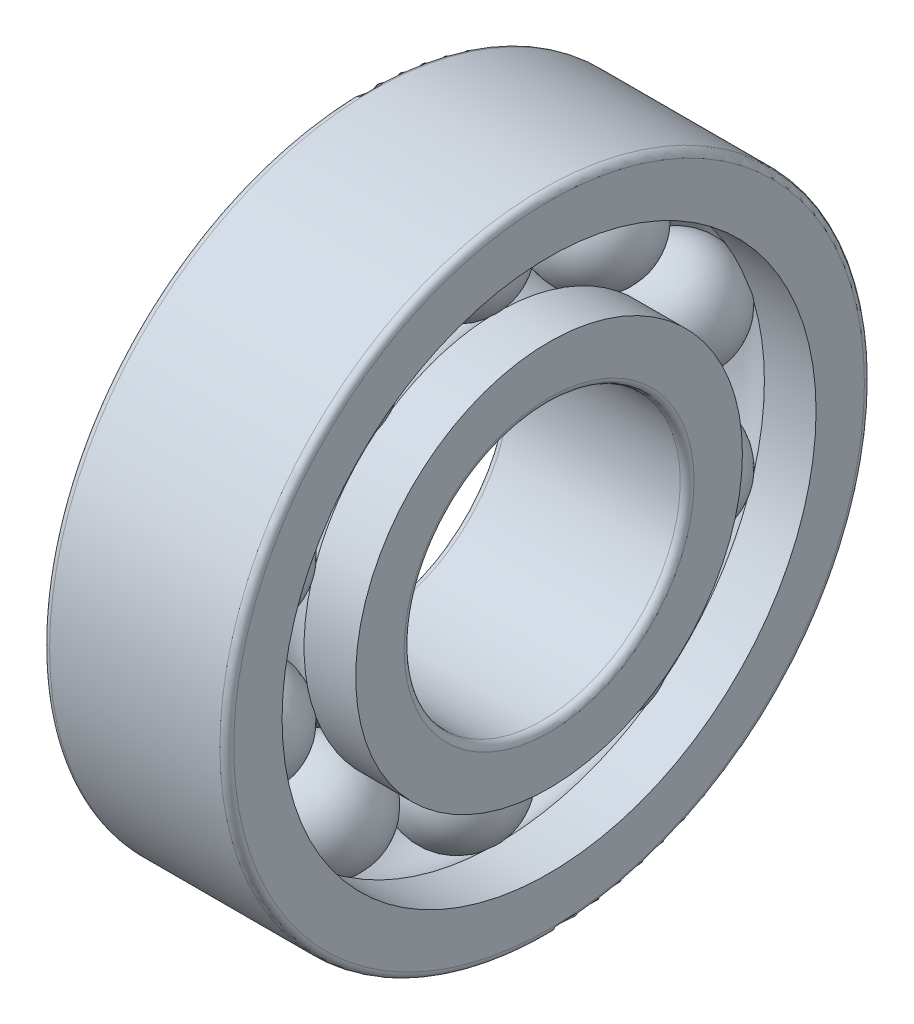
from build123d import *

# Parameters (mm, degrees)
CAGSPISKE_W         = 0.48
CAGSPISKE_H         = 0.8
CAGESPINE_ANGLE     = 0.001
BALLSDETAILED_COUNT = 10
BALLSDETAILED_ANGLE = 324


with BuildPart() as part:
    # CagSpiSke → CageSpine (revolve)
    with BuildSketch(Plane.XY):
        with Locations((0, 10)):
            Rectangle(CAGSPISKE_W, CAGSPISKE_H)
    revolve(axis=Axis((-20.6375, 0, 0), (-1, 0, 0)), revolution_arc=CAGESPINE_ANGLE)

    # BalDetSke → BallDetailed (revolve)
    with BuildSketch(Plane.XY):
        with BuildLine():
            Line((-2.4, 10), (2.4, 10))
            ThreePointArc((2.4, 10), (0, 7.6), (-2.4, 10))
        make_face()
    balldetailed = revolve(axis=Axis((-1.905, 10, 0), (1, 0, 0)))

    # InnRacSke → InnerRace (revolve)
    with BuildSketch(Plane.XY):
        with BuildLine():
            Line((-1.755170932, 8.4), (-4, 8.4))
            Line((-4, 8.4), (-4, 6.3))
            ThreePointArc((-4, 6.3), (-3.912132034, 6.087867966), (-3.7, 6))
            Line((-3.7, 6), (3.7, 6))
            ThreePointArc((3.7, 6), (3.912132034, 6.087867966), (4, 6.3))
            Line((4, 6.3), (4, 8.4))
            Line((4, 8.4), (1.755170932, 8.4))
            ThreePointArc((1.755170932, 8.4), (0, 7.625), (-1.755170932, 8.4))
        make_face()
    revolve(axis=Axis((-20.6375, 0, 0), (1, 0, 0)))

    # OutRacSke → OuterRace (revolve)
    with BuildSketch(Plane.XY):
        with BuildLine():
            Line((-1.755170932, 11.6), (-4, 11.6))
            Line((-4, 11.6), (-4, 13.7))
            ThreePointArc((-4, 13.7), (-3.912132034, 13.912132034), (-3.7, 14))
            Line((-3.7, 14), (3.7, 14))
            ThreePointArc((3.7, 14), (3.912132034, 13.912132034), (4, 13.7))
            Line((4, 13.7), (4, 11.6))
            Line((4, 11.6), (1.755170932, 11.6))
            ThreePointArc((1.755170932, 11.6), (0, 12.375), (-1.755170932, 11.6))
        make_face()
    revolve(axis=Axis((-20.6375, 0, 0), (1, 0, 0)))

    # BallsDetailed: BallDetailed ×10 about axis
    ballsdetailed_axis = Axis((-50, 0, 0), (1, 0, 0))
    for i in range(1, BALLSDETAILED_COUNT):
        add(balldetailed.rotate(ballsdetailed_axis, i * BALLSDETAILED_ANGLE / (BALLSDETAILED_COUNT - 1)))


solid = part.part
